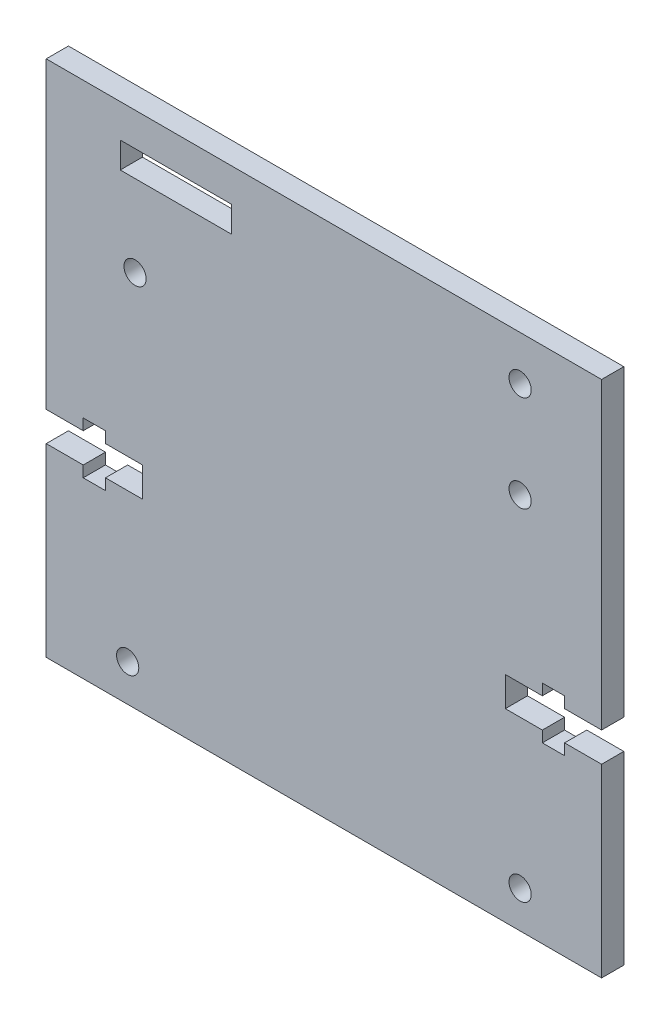
from build123d import *

# Parameters (mm, degrees)
ESQUISSE1_R        = 1.5
ESQUISSE1_W        = 15
ESQUISSE1_H        = 3.5
BOSS_EXTRU_1_DEPTH = 3


with BuildPart() as part:
    # Esquisse1 → Boss.-Extru.1 (new body)
    with BuildSketch(Plane.XY):
        Polygon((-37.5, -21.774747117), (-37.5, -46.774747117), (37.5, -46.774747117), (37.5, -21.774747117), (32.5, -21.774747117), (32.5, -23.274747117), (29.5, -23.274747117), (29.5, -21.774747117), (24.5, -21.774747117), (24.5, -17.774747117), (29.5, -17.774747117), (29.5, -16.274747117), (32.5, -16.274747117), (32.5, -17.774747117), (37.5, -17.774747117), (37.5, 23.225252883), (-37.5, 23.225252883), (-37.5, -17.774747117), (-32.5, -17.774747117), (-32.5, -16.274747117), (-29.5, -16.274747117), (-29.5, -17.774747117), (-24.5, -17.774747117), (-24.5, -21.774747117), (-29.5, -21.774747117), (-29.5, -23.274747117), (-32.5, -23.274747117), (-32.5, -21.774747117), align=None)
        with Locations((-26.5, -41.774747117)):
            Circle(ESQUISSE1_R, mode=Mode.SUBTRACT)
        with Locations((-25.5, 4.225252883)):
            Circle(ESQUISSE1_R, mode=Mode.SUBTRACT)
        with Locations((-20, 16.975252883)):
            Rectangle(ESQUISSE1_W, ESQUISSE1_H, mode=Mode.SUBTRACT)
        with Locations((26.5, 17.225252883)):
            Circle(ESQUISSE1_R, mode=Mode.SUBTRACT)
        with Locations((26.5, -41.774747117)):
            Circle(ESQUISSE1_R, mode=Mode.SUBTRACT)
        with Locations((26.5, 4.225252883)):
            Circle(ESQUISSE1_R, mode=Mode.SUBTRACT)
    extrude(amount=BOSS_EXTRU_1_DEPTH)


solid = part.part
